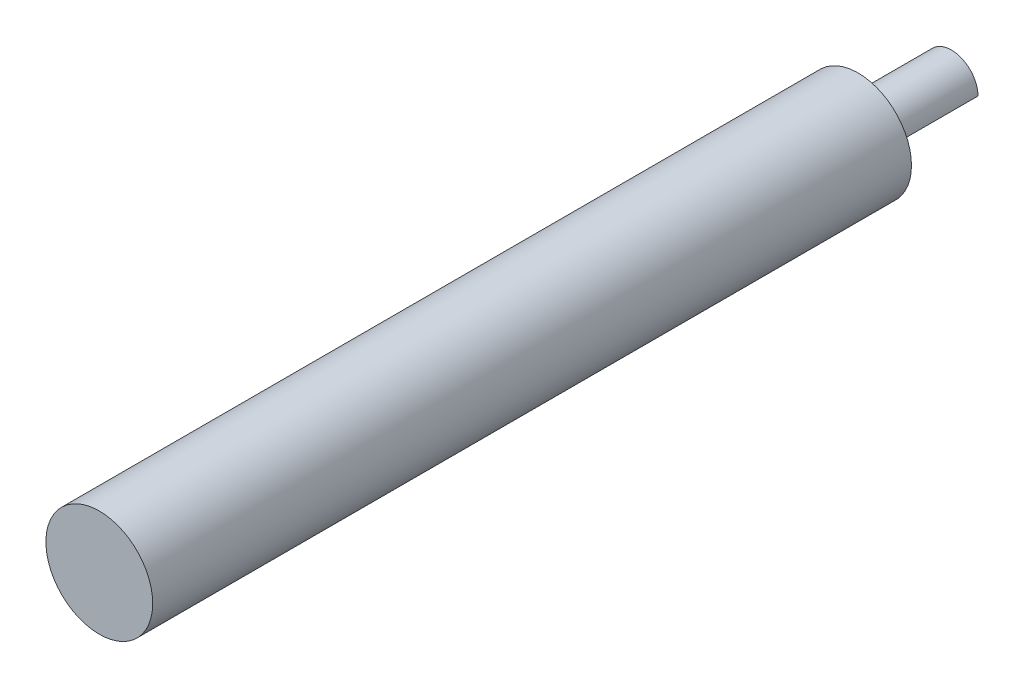
from build123d import *

# Parameters (mm, degrees)
SKETCH1_R               = 3.1623
BOSS_EXTRUDE1_DEPTH     = 11.0998
CUT_EXTRUDE1_DEPTH      = 12.96686436
CUT_EXTRUDE1_DEPTH_BACK = 12.96686436
SKETCH3_R               = 6.35
BOSS_EXTRUDE2_DEPTH     = 90.2208


with BuildPart() as part:
    # Sketch1 → Boss-Extrude1 (new body)
    with BuildSketch(Plane.XY):
        Circle(SKETCH1_R)
    extrude(amount=BOSS_EXTRUDE1_DEPTH)

    # Sketch2 → Cut-Extrude1 (cut, two sides: drawn at the far end of the back side and taken through both)
    with BuildSketch(Plane(origin=(0, 0, 0), x_dir=(-1, 0, 0), z_dir=(0, 0, -1)).offset(-CUT_EXTRUDE1_DEPTH_BACK)):
        Polygon((17.073178183, -20.234228338), (0.001249598, -3.162299753), (-3.162299753, 0.001249598), (-20.234228338, 17.073178183), (-54.378085507, -17.070678986), (-17.070678986, -54.378085507), align=None)
    extrude(amount=CUT_EXTRUDE1_DEPTH + CUT_EXTRUDE1_DEPTH_BACK, mode=Mode.SUBTRACT)

    # Sketch3 → Boss-Extrude2 (add)
    with BuildSketch(Plane.XY.offset(11.0998)):
        Circle(SKETCH3_R)
    extrude(amount=BOSS_EXTRUDE2_DEPTH)


solid = part.part
